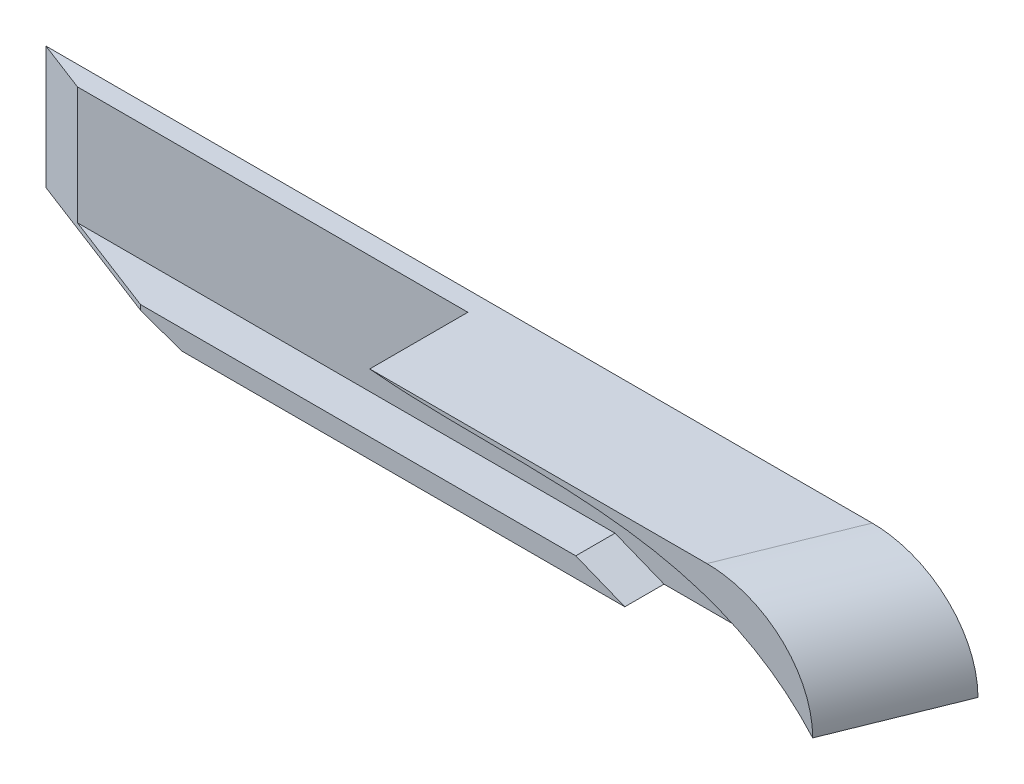
from build123d import *

# Parameters (mm, degrees)
SKETCH1_W           = 85
SKETCH1_H           = 14
BOSS_EXTRUDE1_DEPTH = 2
SKETCH2_W           = 85
SKETCH2_H           = 2
BOSS_EXTRUDE2_DEPTH = 6
CUT_EXTRUDE1_DEPTH  = 4
SKETCH4_W           = 10
SKETCH4_H           = 10
BOSS_EXTRUDE3_DEPTH = 2
CUT_EXTRUDE2_DEPTH  = 20
CHAMFER1_SIZE       = 1.5
SKETCH6_W           = 10
SKETCH6_H           = 10
BOSS_EXTRUDE4_DEPTH = 50
CUT_EXTRUDE3_DEPTH  = 50
FILLET1_R           = 10
CUT_EXTRUDE4_DEPTH  = 10


with BuildPart() as part:
    # Sketch1 → Boss-Extrude1 (new body)
    with BuildSketch(Plane.XY):
        with Locations((-9.558823529, 4.906862745)):
            Rectangle(SKETCH1_W, SKETCH1_H)
    extrude(amount=BOSS_EXTRUDE1_DEPTH)

    # Sketch2 → Boss-Extrude2 (add)
    with BuildSketch(Plane.XY):
        with Locations((-9.558823529, -1.093137255)):
            Rectangle(SKETCH2_W, SKETCH2_H)
    extrude(amount=BOSS_EXTRUDE2_DEPTH)

    # Sketch3 → Cut-Extrude1 (cut)
    with BuildSketch(Plane.XY.offset(6)):
        Polygon((32.941176471, -0.093137255), (7.941176471, -0.093137255), (12.941176471, -2.093137255), (32.941176471, -2.093137255), align=None)
    extrude(amount=-CUT_EXTRUDE1_DEPTH, mode=Mode.SUBTRACT)

    # Sketch4 → Boss-Extrude3 (add)
    with BuildSketch(Plane(origin=(0, 0, 0), x_dir=(-1, 0, 0), z_dir=(0, 0, -1))):
        with Locations((-37.941176471, 6.906862745)):
            Rectangle(SKETCH4_W, SKETCH4_H)
    extrude(amount=-BOSS_EXTRUDE3_DEPTH)

    # Sketch5 → Cut-Extrude2 (cut)
    with BuildSketch(Plane.XZ.offset(2.093137255)):
        Polygon((-52.058823529, 0), (-36.428289141, 6), (-52.058823529, 6), align=None)
    extrude(amount=-CUT_EXTRUDE2_DEPTH, mode=Mode.SUBTRACT)

    # Chamfer1
    chamfer1_edges = [part.edges().sort_by_distance(p)[0] for p in [
        (-44.243556335, -2.093137255, 3),
    ]]
    chamfer(chamfer1_edges, length=CHAMFER1_SIZE)

    # Sketch6 → Boss-Extrude4 (add)
    with BuildSketch(Plane(origin=(42.941176471, 0, 0), x_dir=(0, 0, -1), z_dir=(1, 0, 0))):
        with Locations((-7, 6.906862745)):
            Rectangle(SKETCH6_W, SKETCH6_H)
    extrude(amount=-BOSS_EXTRUDE4_DEPTH)

    # Sketch7 → Cut-Extrude3 (cut)
    with BuildSketch(Plane.XZ.offset(-1.906862745)):
        Polygon((42.941176471, 0), (38.092861761, 12), (42.941176471, 12), align=None)
    extrude(amount=-CUT_EXTRUDE3_DEPTH, mode=Mode.SUBTRACT)

    # Fillet1
    fillet1_edges = [part.edges().sort_by_distance(p)[0] for p in [
        (40.517019116, 11.906862745, 6),
    ]]
    fillet(fillet1_edges, radius=FILLET1_R - 0.0001)  # a hair under: the kernel refuses the full size

    # Sketch8 → Cut-Extrude4 (cut)
    with BuildSketch(Plane.XY.offset(12)):
        with BuildLine():
            Line((-7.058823529, 11.906862745), (-7.058823529, 1.906862745))
            Line((-7.058823529, 1.906862745), (38.092861761, 1.906862745))
            add(Edge.make_bspline(
                [(-7.058823529, 11.906862745), (7.597424673, 10.416193164), (26.985171478, 14.416758063), (38.092861761, 1.906862745)],
                knots=[0, 0, 0, 0, 1, 1, 1, 1], degree=3))
        make_face()
    extrude(amount=-CUT_EXTRUDE4_DEPTH, mode=Mode.SUBTRACT)


solid = part.part
